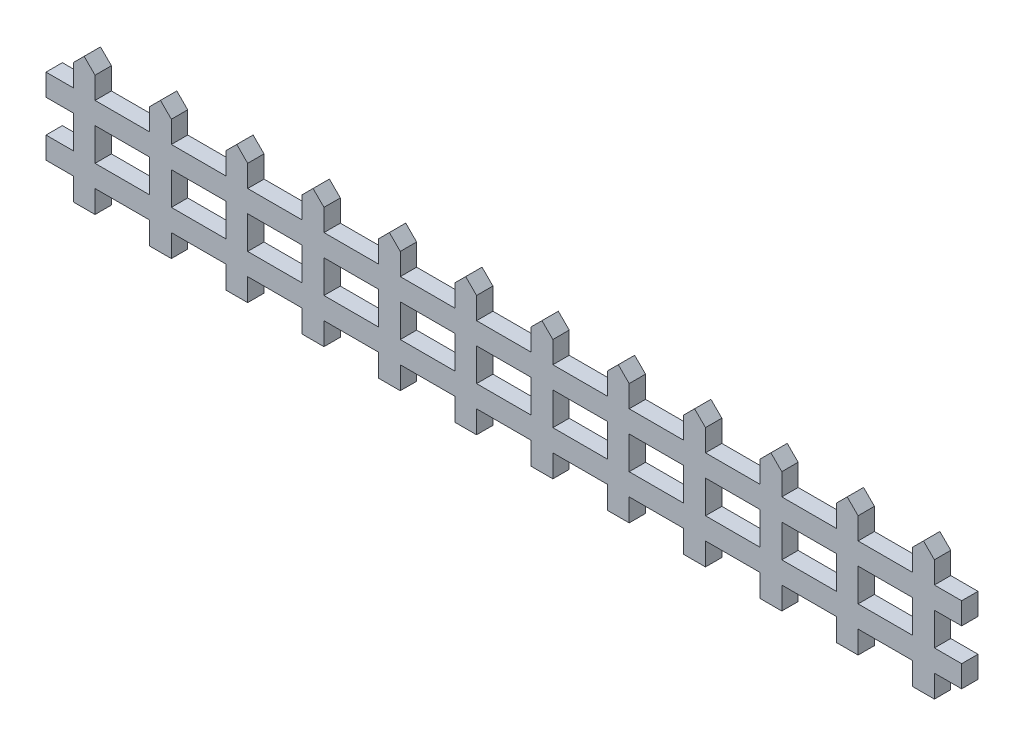
from build123d import *

# Parameters (mm, degrees)
SKETCH1_W                  = 6
SKETCH1_H                  = 10
BOSS_EXTRUDE1_DEPTH        = 3
CHAMFER1_SIZE              = 2
LPATTERN1_COUNT            = 6
LPATTERN1_PITCH            = 28
CHAMFER1_OF_LPATTERN1_SIZE = 2


with BuildPart() as part:
    # Sketch1 → Boss-Extrude1 (new body)
    with BuildSketch(Plane(origin=(0, 0, 0), x_dir=(0, 1, 0), z_dir=(0, 0, 1))):
        Polygon((84.991512901, 53.112203199), (82.991512901, 53.112203199), (80.857353011, 53.112203199), (80.857353011, 49.112203199), (82.991512901, 49.112203199), (84.991512901, 49.112203199), (84.991512901, 44.112203199), (88.991512901, 44.112203199), (88.991512901, 49.112203199), (94.991512901, 49.112203199), (94.991512901, 44.112203199), (98.991512901, 44.112203199), (98.991512901, 49.112203199), (100.991512901, 49.112203199), (105, 49.112203199), (105, 53.112203199), (100.991512901, 53.112203199), (98.991512901, 53.112203199), (98.991512901, 63.112203199), (100.991512901, 63.112203199), (105, 63.112203199), (105, 67.112203199), (100.991512901, 67.112203199), (98.991512901, 67.112203199), (98.991512901, 72.112203199), (94.991512901, 72.112203199), (94.991512901, 67.112203199), (88.991512901, 67.112203199), (88.991512901, 72.112203199), (84.991512901, 72.112203199), (84.991512901, 67.112203199), (82.991512901, 67.112203199), (80.857353011, 67.112203199), (80.857353011, 63.112203199), (82.991512901, 63.112203199), (84.991512901, 63.112203199), align=None)
        with Locations((91.991512901, 58.112203199)):
            Rectangle(SKETCH1_W, SKETCH1_H, mode=Mode.SUBTRACT)
    boss_extrude1 = extrude(amount=BOSS_EXTRUDE1_DEPTH)

    # Chamfer1
    chamfer1_edges = [part.edges().sort_by_distance(p)[0] for p in [
        (-49.112203199, 105, 1.5),
        (-53.112203199, 105, 1.5),
        (-63.112203199, 105, 1.5),
        (-67.112203199, 105, 1.5),
    ]]
    chamfer(chamfer1_edges, length=CHAMFER1_SIZE - 0.0001)  # a hair under: the kernel refuses the full size

    # LPattern1: Boss-Extrude1 ×6
    with Locations(*[(i * LPATTERN1_PITCH, 0, 0) for i in range(1, LPATTERN1_COUNT)]):
        add(boss_extrude1)

    # Chamfer1 of LPattern1
    chamfer1_of_lpattern1_edges = [part.edges().sort_by_distance(p)[0] for p in [
        (-21.112203199, 105, 1.5),
        (-25.112203199, 105, 1.5),
        (-35.112203199, 105, 1.5),
        (-39.112203199, 105, 1.5),
        (6.887796801, 105, 1.5),
        (2.887796801, 105, 1.5),
        (-7.112203199, 105, 1.5),
        (-11.112203199, 105, 1.5),
        (34.887796801, 105, 1.5),
        (30.887796801, 105, 1.5),
        (20.887796801, 105, 1.5),
        (16.887796801, 105, 1.5),
        (62.887796801, 105, 1.5),
        (58.887796801, 105, 1.5),
        (48.887796801, 105, 1.5),
        (44.887796801, 105, 1.5),
        (90.887796801, 105, 1.5),
        (86.887796801, 105, 1.5),
        (76.887796801, 105, 1.5),
        (72.887796801, 105, 1.5),
    ]]
    chamfer(chamfer1_of_lpattern1_edges, length=CHAMFER1_OF_LPATTERN1_SIZE - 0.0001)  # a hair under: the kernel refuses the full size


solid = part.part
